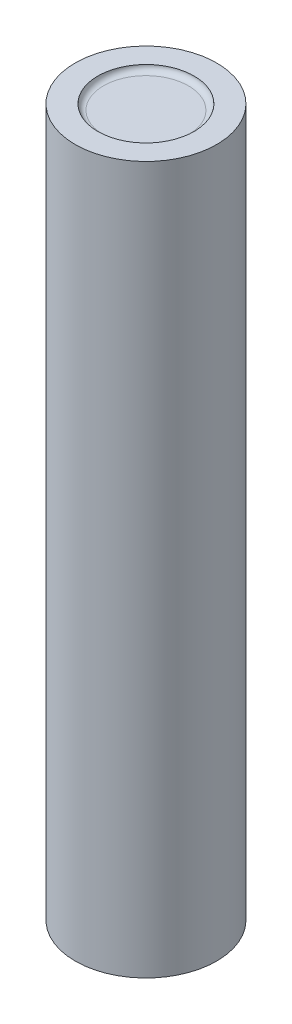
from build123d import *

# Parameters (mm, degrees)
SKETCH_1_R          = 12.5
EXTRUDE_1_DEPTH     = 125
SKETCH_2_R          = 5
EXTRUDE_2_DEPTH     = 5
FILLET_1_R          = 1
SKETCH_3_R          = 8.5
CUT_EXTRUDE_1_DEPTH = 1
FILLET_2_R          = 1


with BuildPart() as part:
    # 草图1 → 凸台-拉伸1 (new body)
    with BuildSketch(Plane(origin=(0, 0, 0), x_dir=(1, 0, 0), z_dir=(0, 1, 0))):
        with Locations(Location((0, 0, 0), (0, 0, 270))):
            Circle(SKETCH_1_R)
    extrude(amount=EXTRUDE_1_DEPTH)

    # 草图2 → 凸台-拉伸2 (add)
    with BuildSketch(Plane(origin=(0, 0, 0), x_dir=(1, 0, 0), z_dir=(0, 1, 0))):
        with Locations(Location((0, 0, 0), (0, 0, 270))):
            Circle(SKETCH_2_R)
    extrude(amount=-EXTRUDE_2_DEPTH)

    # 圆角1
    fillet_1_edges = [part.edges().sort_by_distance(p)[0] for p in [
        (0, -5, -5),
    ]]
    fillet(fillet_1_edges, radius=FILLET_1_R)

    # 草图3 → 切除-拉伸1 (cut)
    with BuildSketch(Plane(origin=(0, 125, 0), x_dir=(1, 0, 0), z_dir=(0, 1, 0))):
        with Locations(Location((0, 0, 0), (0, 0, 270))):
            Circle(SKETCH_3_R)
    extrude(amount=-CUT_EXTRUDE_1_DEPTH, mode=Mode.SUBTRACT)

    # 圆角2
    fillet_2_edges = [part.edges().sort_by_distance(p)[0] for p in [
        (0, 124, -8.5),
    ]]
    fillet(fillet_2_edges, radius=FILLET_2_R - 0.0001)  # a hair under: the kernel refuses the full size


solid = part.part
